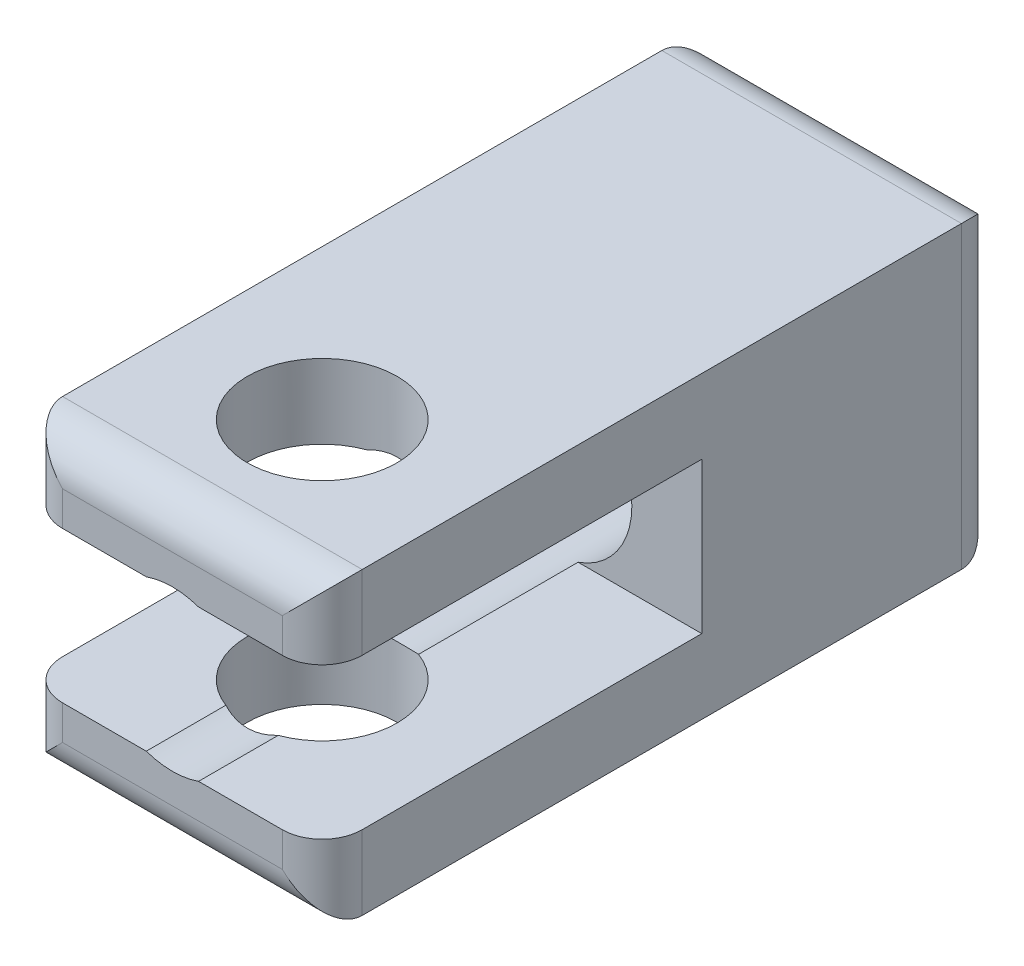
from build123d import *

# Parameters (mm, degrees)
SKETCH1_W           = 19.05
SKETCH1_H           = 19.05
BOSS_EXTRUDE1_DEPTH = 43.18
FILLET1_R           = 2.54
CUT_EXTRUDE1_REACH  = 52.895
SKETCH2_R           = 5.08
SKETCH3_W           = 43.18
SKETCH3_H           = 9.6012
CUT_EXTRUDE2_DEPTH  = 51.89516087
SKETCH4_R           = 4.7625
CUT_EXTRUDE3_DEPTH  = 51.89516087


with BuildPart() as part:
    # Sketch1 → Boss-Extrude1 (new body)
    with BuildSketch(Plane.XY):
        with Locations((9.525, 9.525)):
            Rectangle(SKETCH1_W, SKETCH1_H)
    extrude(amount=BOSS_EXTRUDE1_DEPTH)

    # Fillet1
    fillet1_edges = [part.edges().sort_by_distance(p)[0] for p in [
        (9.525, 0, 0),
        (19.05, 9.525, 0),
        (9.525, 19.05, 0),
        (0, 9.525, 0),
        (9.525, 19.05, 43.18),
        (19.05, 9.525, 43.18),
        (9.525, 0, 43.18),
        (0, 9.525, 43.18),
    ]]
    fillet(fillet1_edges, radius=FILLET1_R)

    # Sketch2 → Cut-Extrude1 (cut, up to next)
    with BuildSketch(Plane(origin=(0, 0, 0), x_dir=(-1, 0, 0), z_dir=(0, 0, -1)), mode=Mode.PRIVATE) as cut_extrude1_sk1:
        with Locations((-9.525, 9.525)):
            Circle(SKETCH2_R)
    cut_extrude1_tool1 = extrude(cut_extrude1_sk1.sketch, amount=-CUT_EXTRUDE1_REACH, mode=Mode.PRIVATE) & part.part
    add(cut_extrude1_tool1.solids().sort_by_distance((9.525, 9.525, 0))[0], mode=Mode.SUBTRACT)

    # Sketch3 → Cut-Extrude2 (cut, through all)
    with BuildSketch(Plane(origin=(19.05, 0, 0), x_dir=(0, 0, -1), z_dir=(1, 0, 0))):
        with Locations((-40.64, 9.525)):
            Rectangle(SKETCH3_W, SKETCH3_H)
    extrude(amount=-CUT_EXTRUDE2_DEPTH, mode=Mode.SUBTRACT)

    # Sketch4 → Cut-Extrude3 (cut, through all)
    with BuildSketch(Plane.XZ):
        with Locations((9.525, 33.655)):
            Circle(SKETCH4_R)
    extrude(amount=-CUT_EXTRUDE3_DEPTH, mode=Mode.SUBTRACT)


solid = part.part
